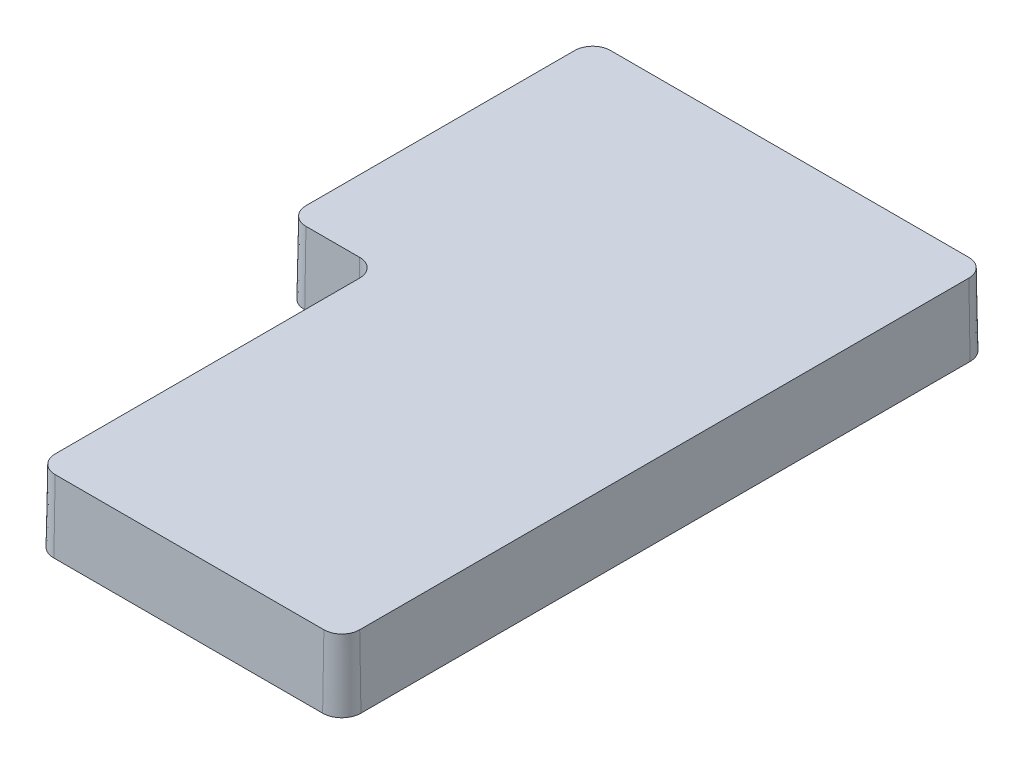
from build123d import *

# Parameters (mm, degrees)
BOSS_EXTRUDE1_DEPTH           = 4
BOSS_EXTRUDE1_DRAFT           = 1
SHELL1_T                      = -0.5
SKETCH2_R                     = 3
BOSS_EXTRUDE2_DEPTH           = 4
BOSS_EXTRUDE2_DRAFT           = 1.5
BOSS_EXTRUDE2_PROFILE_2_DEPTH = 4
BOSS_EXTRUDE2_PROFILE_2_DRAFT = 1.5
BOSS_EXTRUDE2_PROFILE_3_DEPTH = 4
BOSS_EXTRUDE2_PROFILE_3_DRAFT = 1.5
BOSS_EXTRUDE2_PROFILE_4_DEPTH = 4
BOSS_EXTRUDE2_PROFILE_4_DRAFT = 1.5


with BuildPart() as part:
    # Sketch1 → Boss-Extrude1 (with draft: the straight prism first)
    with BuildSketch(Plane(origin=(0, 0, 0), x_dir=(1, 0, 0), z_dir=(0, 1, 0))):
        with BuildLine():
            Line((9.307147932, 15.453623562), (-10.692852068, 15.453623562))
            ThreePointArc((-10.692852068, 15.453623562), (-11.399958849, 15.160730343), (-11.692852068, 14.453623562))
            Line((-11.692852068, 14.453623562), (-11.692852068, -0.546376438))
            ThreePointArc((-11.692852068, -0.546376438), (-11.399958849, -1.253483219), (-10.692852068, -1.546376438))
            Line((-10.692852068, -1.546376438), (-7.692852068, -1.546376438))
            ThreePointArc((-7.692852068, -1.546376438), (-6.985745287, -1.839269657), (-6.692852068, -2.546376438))
            Line((-6.692852068, -2.546376438), (-6.692852068, -19.546376438))
            ThreePointArc((-6.692852068, -19.546376438), (-6.399958849, -20.253483219), (-5.692852068, -20.546376438))
            Line((-5.692852068, -20.546376438), (9.307147932, -20.546376438))
            ThreePointArc((9.307147932, -20.546376438), (10.014254713, -20.253483219), (10.307147932, -19.546376438))
            Line((10.307147932, -19.546376438), (10.307147932, 14.453623562))
            ThreePointArc((10.307147932, 14.453623562), (10.014254713, 15.160730343), (9.307147932, 15.453623562))
        make_face()
    extrude(amount=-BOSS_EXTRUDE1_DEPTH)
    # Boss-Extrude1: the draft: its side faces are tilted about the plane it starts from
    boss_extrude1_sides = [part.faces().sort_by_distance(p)[0] for p in [
        (-0.692852068, -2, -15.453623562),
        (-11.399958849, -2, -15.160730343),
        (-11.692852068, -2, -6.953623562),
        (-11.399958849, -2, 1.253483219),
        (-9.192852068, -2, 1.546376438),
        (-6.985745287, -2, 1.839269657),
        (-6.692852068, -2, 11.046376438),
        (-6.399958849, -2, 20.253483219),
        (1.807147932, -2, 20.546376438),
        (10.014254713, -2, 20.253483219),
        (10.307147932, -2, 2.546376438),
        (10.014254713, -2, -15.160730343),
    ]]
    draft(boss_extrude1_sides, Plane(origin=(0, 0, 0), x_dir=(1, 0, 0), z_dir=(0, 1, 0)), BOSS_EXTRUDE1_DRAFT)

    # Shell1
    shell1_openings = [part.faces().sort_by_distance(p)[0] for p in [
        (0.463840033, -4, 1.39028021),
    ]]
    offset(amount=SHELL1_T, openings=shell1_openings, kind=Kind.INTERSECTION)


with BuildPart() as boss_extrude2_tool:
    # Sketch2 → Boss-Extrude2 (with draft: the straight prism first)
    with BuildSketch(Plane(origin=(0, -0.5, 0), x_dir=(-1, 0, 0), z_dir=(0, -1, 0))):
        with Locations((-4.582877633, 9.497221709)):
            Circle(SKETCH2_R)
    extrude(amount=BOSS_EXTRUDE2_DEPTH)
    # Boss-Extrude2: the draft: its side faces are tilted about the plane it starts from
    boss_extrude2_sides = [boss_extrude2_tool.faces().sort_by_distance(p)[0] for p in [
        (7.582877633, -2.5, -9.497221709),
    ]]
    draft(boss_extrude2_sides, Plane(origin=(0, -0.5, 0), x_dir=(-1, 0, 0), z_dir=(0, -1, 0)), BOSS_EXTRUDE2_DRAFT)


with BuildPart() as part_1:
    add(part.part)

    # Boss-Extrude2: add boss_extrude2_tool
    add(boss_extrude2_tool.part)


with BuildPart() as boss_extrude2_profile_2_tool:
    # Sketch2 → Boss-Extrude2 profile 2 (with draft: the straight prism first)
    with BuildSketch(Plane(origin=(0, -0.5, 0), x_dir=(-1, 0, 0), z_dir=(0, -1, 0))):
        with Locations((7.286983005, 9.497221709)):
            Circle(SKETCH2_R)
    extrude(amount=BOSS_EXTRUDE2_PROFILE_2_DEPTH)
    # Boss-Extrude2 profile 2: the draft: its side faces are tilted about the plane it starts from
    boss_extrude2_profile_2_sides = [boss_extrude2_profile_2_tool.faces().sort_by_distance(p)[0] for p in [
        (-4.286983005, -2.5, -9.497221709),
    ]]
    draft(boss_extrude2_profile_2_sides, Plane(origin=(0, -0.5, 0), x_dir=(-1, 0, 0), z_dir=(0, -1, 0)), BOSS_EXTRUDE2_PROFILE_2_DRAFT)


with BuildPart() as part_2:
    add(part_1.part)

    # Boss-Extrude2 profile 2: add boss_extrude2_profile_2_tool
    add(boss_extrude2_profile_2_tool.part)


with BuildPart() as boss_extrude2_profile_3_tool:
    # Sketch2 → Boss-Extrude2 profile 3 (with draft: the straight prism first)
    with BuildSketch(Plane(origin=(0, -0.5, 0), x_dir=(-1, 0, 0), z_dir=(0, -1, 0))):
        with Locations((-4.582877633, -14.339396389)):
            Circle(SKETCH2_R)
    extrude(amount=BOSS_EXTRUDE2_PROFILE_3_DEPTH)
    # Boss-Extrude2 profile 3: the draft: its side faces are tilted about the plane it starts from
    boss_extrude2_profile_3_sides = [boss_extrude2_profile_3_tool.faces().sort_by_distance(p)[0] for p in [
        (7.582877633, -2.5, 14.339396389),
    ]]
    draft(boss_extrude2_profile_3_sides, Plane(origin=(0, -0.5, 0), x_dir=(-1, 0, 0), z_dir=(0, -1, 0)), BOSS_EXTRUDE2_PROFILE_3_DRAFT)


with BuildPart() as part_3:
    add(part_2.part)

    # Boss-Extrude2 profile 3: add boss_extrude2_profile_3_tool
    add(boss_extrude2_profile_3_tool.part)


with BuildPart() as boss_extrude2_profile_4_tool:
    # Sketch2 → Boss-Extrude2 profile 4 (with draft: the straight prism first)
    with BuildSketch(Plane(origin=(0, -0.5, 0), x_dir=(-1, 0, 0), z_dir=(0, -1, 0))):
        with Locations((2.635935572, -14.339396389)):
            Circle(SKETCH2_R)
    extrude(amount=BOSS_EXTRUDE2_PROFILE_4_DEPTH)
    # Boss-Extrude2 profile 4: the draft: its side faces are tilted about the plane it starts from
    boss_extrude2_profile_4_sides = [boss_extrude2_profile_4_tool.faces().sort_by_distance(p)[0] for p in [
        (0.364064428, -2.5, 14.339396389),
    ]]
    draft(boss_extrude2_profile_4_sides, Plane(origin=(0, -0.5, 0), x_dir=(-1, 0, 0), z_dir=(0, -1, 0)), BOSS_EXTRUDE2_PROFILE_4_DRAFT)


with BuildPart() as part_4:
    add(part_3.part)

    # Boss-Extrude2 profile 4: add boss_extrude2_profile_4_tool
    add(boss_extrude2_profile_4_tool.part)


solid = part_4.part
